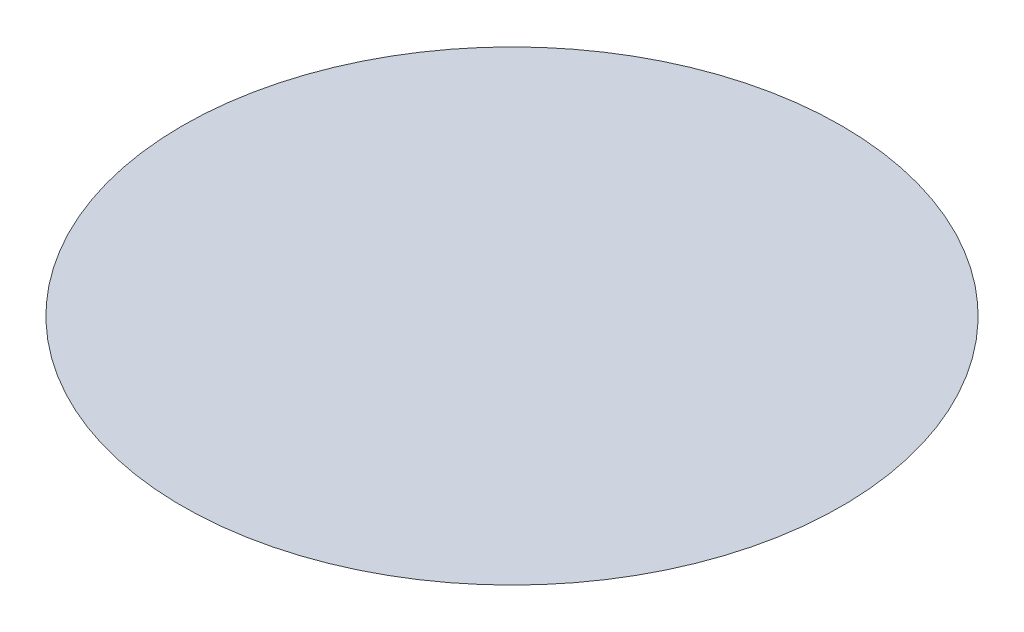
from build123d import *


with BuildPart() as part:
    # Sketch1 → Revolve1 (revolve)
    with BuildSketch(Plane.XY):
        with BuildLine():
            Line((0, 0), (0, 28.5))
            Line((0, 28.5), (102.903717134, 28.5))
            ThreePointArc((102.903717134, 28.5), (53.388727743, 7.256630253), (0, 0))
        make_face()
    revolve(axis=Axis((0, 0, 0), (0, 1, 0)))


solid = part.part
